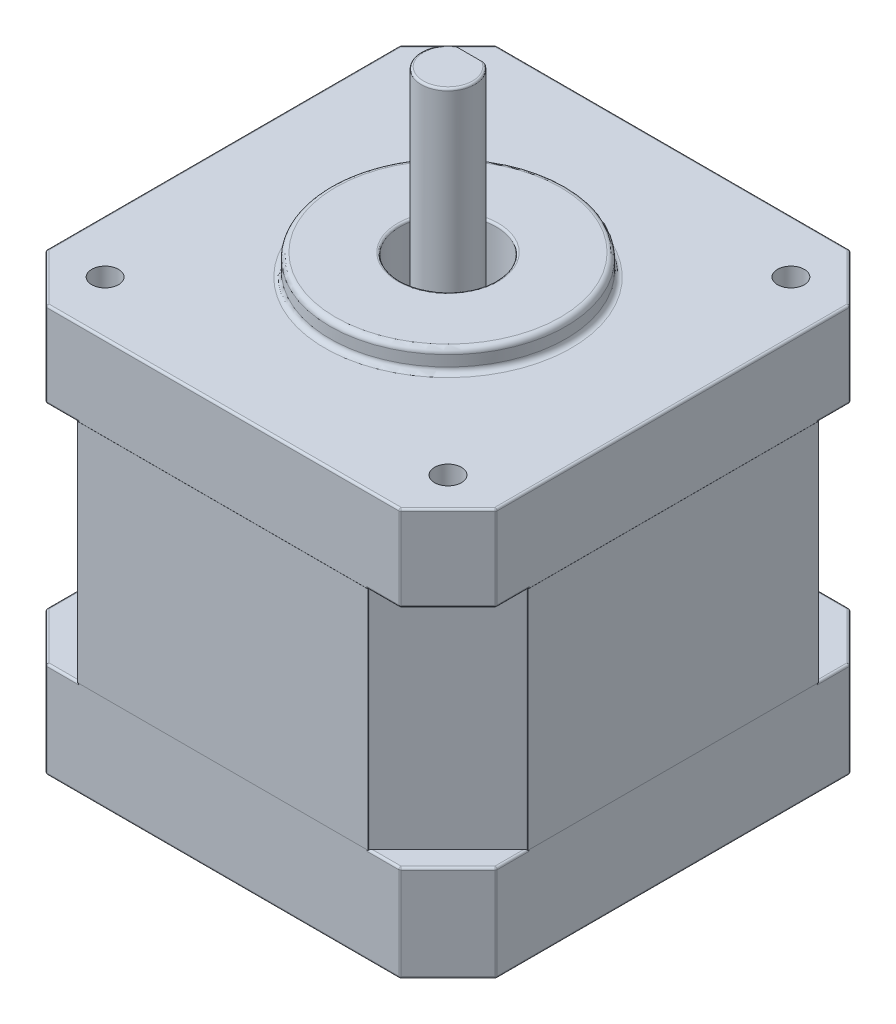
from build123d import *

# Parameters (mm, degrees)
IZIM1_R                          = 1.25
IZIM1_R_2                        = 4.5
Y_KSEKLIK_EKSTR_ZYON1_DEPTH      = 9
IZIM2_W                          = 16
IZIM2_H                          = 4
KES_EKSTR_ZYON1_DEPTH            = 6
IZIM3_W                          = 16
IZIM3_H                          = 5
Y_KSEKLIK_EKSTR_ZYON2_DEPTH      = 0.5
Y_KSEKLIK_EKSTR_ZYON3_DEPTH      = 5
IZIM6_R                          = 3
KES_EKSTR_ZYON2_DEPTH            = 3
IZIM7_R                          = 4.5
Y_KSEKLIK_EKSTR_ZYON4_DEPTH      = 21
IZIM8_R                          = 4.5
Y_KSEKLIK_EKSTR_ZYON5_DEPTH      = 8
IZIM9_R                          = 1.25
KES_EKSTR_ZYON3_DEPTH            = 45.544921147
IZIM10_R                         = 11
IZIM10_R_2                       = 4.5
Y_KSEKLIK_EKSTR_ZYON6_DEPTH      = 2
RADYUS1_R                        = 0.5
RADYUS2_R                        = 0.2
Y_KSEKLIK_EKSTR_ZYON7_DEPTH      = 11.5
Y_KSEKLIK_EKSTR_ZYON7_DEPTH_BACK = 11.5
IZIM11_R                         = 4.5
IZIM11_R_2                       = 2.5
RADYUS3_R                        = 0.2
IZIM12_R                         = 2.5
Y_KSEKLIK_EKSTR_ZYON8_DEPTH      = 50
IZIM13_W                         = 5.925379232
IZIM13_H                         = 1.11963419
KES_EKSTR_ZYON4_DEPTH            = 18
IZIM14_R                         = 0.25
Y_KSEKLIK_EKSTR_ZYON9_DEPTH      = 3
IZIM15_W                         = 16
IZIM15_H                         = 0.5
Y_KSEKLIK_EKSTR_ZYON11_DEPTH     = 5.5
IZIM17_W                         = 27.117157288
IZIM17_H                         = 21.117157288
Y_KSEKLIK_EKSTR_ZYON13_DEPTH     = 0.01
IZIM18_W                         = 27.117157288
IZIM18_H                         = 21.117157288
Y_KSEKLIK_EKSTR_ZYON14_DEPTH     = 0.01
IZIM19_W                         = 27.117157288
IZIM19_H                         = 21.117157288
Y_KSEKLIK_EKSTR_ZYON15_DEPTH     = 0.01
IZIM20_W                         = 27.117157288
IZIM20_H                         = 21.117157288
Y_KSEKLIK_EKSTR_ZYON16_DEPTH     = 0.01


with BuildPart() as part:
    # Çizim1 → Yükseklik-Ekstrüzyon1 (new body)
    with BuildSketch(Plane(origin=(0, 0, 0), x_dir=(1, 0, 0), z_dir=(0, 1, 0))):
        Polygon((-21, 16.5), (-16.5, 21), (-8, 21), (-8, 25), (8, 25), (8, 21), (16.5, 21), (21, 16.5), (21, -16.5), (16.5, -21), (-16.5, -21), (-21, -16.5), align=None)
        with Locations(Location((-16, 16, 0), (0, 0, 270))):
            Circle(IZIM1_R, mode=Mode.SUBTRACT)
        with Locations(Location((16, 16, 0), (0, 0, 90))):
            Circle(IZIM1_R, mode=Mode.SUBTRACT)
        with Locations(Location((16, -16, 0), (0, 0, 270))):
            Circle(IZIM1_R, mode=Mode.SUBTRACT)
        with Locations(Location((-16, -16, 0), (0, 0, 90))):
            Circle(IZIM1_R, mode=Mode.SUBTRACT)
        with Locations(Location((0, 0, 0), (0, 0, 270))):
            Circle(IZIM1_R_2, mode=Mode.SUBTRACT)
    extrude(amount=Y_KSEKLIK_EKSTR_ZYON1_DEPTH)

    # Çizim2 → Kes-Ekstrüzyon1 (cut)
    with BuildSketch(Plane(origin=(0, 9, 0), x_dir=(1, 0, 0), z_dir=(0, 1, 0))):
        with Locations((0, 23)):
            Rectangle(IZIM2_W, IZIM2_H)
    extrude(amount=-KES_EKSTR_ZYON1_DEPTH, mode=Mode.SUBTRACT)

    # Çizim3 → Yükseklik-Ekstrüzyon2 (add)
    with BuildSketch(Plane(origin=(0, 0, -21), x_dir=(-1, 0, 0), z_dir=(0, 0, -1))):
        with Locations((0, 6.5)):
            Rectangle(IZIM3_W, IZIM3_H)
    extrude(amount=Y_KSEKLIK_EKSTR_ZYON2_DEPTH)

    # Çizim4 → Yükseklik-Ekstrüzyon3 (add)
    with BuildSketch(Plane(origin=(0, 0, -21.5), x_dir=(-1, 0, 0), z_dir=(0, 0, -1))):
        Polygon((4, 9), (8, 9), (8, 4), (-8, 4), (-8, 9), (-4, 9), (-4, 8.5), (-7.5, 8.5), (-7.5, 4.5), (7.5, 4.5), (7.5, 8.5), (4, 8.5), align=None)
    extrude(amount=Y_KSEKLIK_EKSTR_ZYON3_DEPTH)

    # Çizim6 → Kes-Ekstrüzyon2 (cut)
    with BuildSketch(Plane.XZ):
        with Locations(Location((16, -16, 0), (0, 0, 270))):
            Circle(IZIM6_R)
        with Locations(Location((-16, -16, 0), (0, 0, 90))):
            Circle(IZIM6_R)
        with Locations(Location((-16, 16, 0), (0, 0, 270))):
            Circle(IZIM6_R)
        with Locations(Location((16, 16, 0), (0, 0, 90))):
            Circle(IZIM6_R)
    extrude(amount=-KES_EKSTR_ZYON2_DEPTH, mode=Mode.SUBTRACT)

    # Çizim7 → Yükseklik-Ekstrüzyon4 (add)
    with BuildSketch(Plane(origin=(0, 9, 0), x_dir=(1, 0, 0), z_dir=(0, 1, 0))):
        Polygon((-13.5, 21), (13.5, 21), (21, 13.5), (21, -13.5), (13.5, -21), (-13.5, -21), (-21, -13.5), (-21, 13.5), align=None)
        with Locations(Location((0, 0, 0), (0, 0, 270))):
            Circle(IZIM7_R, mode=Mode.SUBTRACT)
    extrude(amount=Y_KSEKLIK_EKSTR_ZYON4_DEPTH)

    # Çizim8 → Yükseklik-Ekstrüzyon5 (add)
    with BuildSketch(Plane(origin=(0, 30, 0), x_dir=(1, 0, 0), z_dir=(0, 1, 0))):
        Polygon((-16.5, 21), (16.5, 21), (21, 16.5), (21, -16.5), (16.5, -21), (-16.5, -21), (-21, -16.5), (-21, 16.5), align=None)
        with Locations(Location((0, 0, 0), (0, 0, 270))):
            Circle(IZIM8_R, mode=Mode.SUBTRACT)
    extrude(amount=Y_KSEKLIK_EKSTR_ZYON5_DEPTH)

    # Çizim9 → Kes-Ekstrüzyon3 (cut, through all)
    with BuildSketch(Plane.XZ.offset(-9)):
        with Locations(Location((-16, 16, 0), (0, 0, 270))):
            Circle(IZIM9_R)
        with Locations(Location((16, 16, 0), (0, 0, 270))):
            Circle(IZIM9_R)
        with Locations(Location((16, -16, 0), (0, 0, 270))):
            Circle(IZIM9_R)
        with Locations(Location((-16, -16, 0), (0, 0, 270))):
            Circle(IZIM9_R)
    extrude(amount=-KES_EKSTR_ZYON3_DEPTH, mode=Mode.SUBTRACT)

    # Çizim10 → Yükseklik-Ekstrüzyon6 (add)
    with BuildSketch(Plane(origin=(0, 38, 0), x_dir=(1, 0, 0), z_dir=(0, 1, 0))):
        with Locations(Location((0, 0, 0), (0, 0, 90))):
            Circle(IZIM10_R)
        with Locations(Location((0, 0, 0), (0, 0, 270))):
            Circle(IZIM10_R_2, mode=Mode.SUBTRACT)
    extrude(amount=Y_KSEKLIK_EKSTR_ZYON6_DEPTH)

    # Radyus1
    radyus1_edges = [part.edges().sort_by_distance(p)[0] for p in [
        (0, 38, 11),
        (0, 40, 11),
    ]]
    fillet(radyus1_edges, radius=RADYUS1_R)

    # Radyus2
    radyus2_edges = [part.edges().sort_by_distance(p)[0] for p in [
        (-21, 9, -15),
        (-8, 0, -23),
        (0, 0, -25),
        (8, 0, -23),
        (12.25, 0, -21),
        (18.75, 0, -18.75),
        (21, 0, 0),
        (-18.75, 9, 18.75),
        (18.75, 0, 18.75),
        (0, 0, 21),
        (-18.75, 0, 18.75),
        (-15, 9, -21),
        (-21, 9, 15),
        (15, 9, 21),
        (21, 9, -15),
        (-21, 0, 0),
        (-18.75, 0, -18.75),
        (-13.5, 19.5, -21),
        (-21, 19.5, -13.5),
        (-21, 19.5, 13.5),
        (-12.25, 0, -21),
        (-13.5, 19.5, 21),
        (13.5, 19.5, 21),
        (21, 19.5, 13.5),
        (21, 19.5, -13.5),
        (13.5, 19.5, -21),
        (-15, 9, 21),
        (-18.75, 38, -18.75),
        (-21, 38, 0),
        (-18.75, 38, 18.75),
        (0, 38, 21),
        (18.75, 38, 18.75),
        (21, 38, 0),
        (18.75, 38, -18.75),
        (0, 38, -21),
        (-18.75, 30, -18.75),
        (-16.5, 34, -21),
        (-21, 30, -15),
        (-21, 30, 15),
        (-21, 34, -16.5),
        (-18.75, 30, 18.75),
        (-21, 34, 16.5),
        (-15, 30, 21),
        (15, 30, 21),
        (-16.5, 34, 21),
        (18.75, 30, 18.75),
        (16.5, 34, 21),
        (21, 30, 15),
        (21, 30, -15),
        (21, 34, 16.5),
        (18.75, 30, -18.75),
        (21, 34, -16.5),
        (15, 30, -21),
        (-15, 30, -21),
        (16.5, 34, -21),
        (18.75, 9, 18.75),
        (16.5, 4.5, -21),
        (21, 4.5, -16.5),
        (21, 4.5, 16.5),
        (16.5, 4.5, 21),
        (-16.5, 4.5, 21),
        (-21, 4.5, 16.5),
        (-21, 4.5, -16.5),
        (-16.5, 4.5, -21),
        (21, 9, 15),
        (18.75, 9, -18.75),
        (15, 9, -21),
        (-8, 1.5, -21),
        (-8, 1.5, -25),
        (8, 1.5, -25),
        (8, 1.5, -21),
        (8, 3, -23),
        (0, 3, -21),
        (-8, 3, -23),
        (0, 3, -25),
        (-18.75, 9, -18.75),
    ]]
    fillet(radyus2_edges, radius=RADYUS2_R)

    # Çizim11 → Yükseklik-Ekstrüzyon7 (add, two sides: drawn at the far end of the back side and taken through both)
    with BuildSketch(Plane(origin=(0, 16.5, 0), x_dir=(-1, 0, 0), z_dir=(0, -1, 0)).offset(-Y_KSEKLIK_EKSTR_ZYON7_DEPTH_BACK)):
        with Locations(Location((0, 0, 0), (0, 0, 90))):
            Circle(IZIM11_R)
        with Locations(Location((0, 0, 0), (0, 0, 90))):
            Circle(IZIM11_R_2, mode=Mode.SUBTRACT)
    extrude(amount=Y_KSEKLIK_EKSTR_ZYON7_DEPTH + Y_KSEKLIK_EKSTR_ZYON7_DEPTH_BACK)

    # Radyus3
    radyus3_edges = [part.edges().sort_by_distance(p)[0] for p in [
        (16, 3, 13),
        (16, 0, 13),
        (-16, 3, 19),
        (-16, 0, 19),
        (-16, 3, -19),
        (-16, 0, -19),
        (16, 3, -13),
        (16, 3, -14.75),
        (16, 0, -13),
        (0, 40, -4.5),
        (0, 0, -4.5),
        (0, 5, -4.5),
        (0, 28, 2.5),
        (0, 5, 2.5),
    ]]
    fillet(radyus3_edges, radius=RADYUS3_R)

    # Çizim12 → Yükseklik-Ekstrüzyon8 (add)
    with BuildSketch(Plane.XZ.offset(-5)):
        with Locations(Location((0, 0, 0), (0, 0, 270))):
            Circle(IZIM12_R)
    extrude(amount=-Y_KSEKLIK_EKSTR_ZYON8_DEPTH)

    # Radyus4: read off the stored shape, not the designer's step
    # Radyus4 outline → Radyus4 (revolve, cut)
    with BuildSketch(Plane.XY):
        with BuildLine():
            ThreePointArc((2.3, 55), (2.441421356, 54.941421356), (2.5, 54.8))
            Line((2.5, 54.8), (2.5, 55))
            Line((2.5, 55), (2.3, 55))
        make_face()
    revolve(axis=Axis((0, 0, 0), (0, 1, 0)), mode=Mode.SUBTRACT)

    # Radyus4 2 outline → Radyus4 2 (revolve)
    with BuildSketch(Plane.XY):
        with BuildLine():
            Line((2.641143783, 5.008856217), (2.641143783, 5.2))
            Line((2.641143783, 5.2), (2.5, 5.2))
            Line((2.5, 5.2), (2.5, 5))
            ThreePointArc((2.5, 5), (2.569762983, 5.017319886), (2.641143783, 5.008856217))
        make_face()
    revolve(axis=Axis((0, 0, 0), (0, 1, 0)))

    # Çizim13 → Kes-Ekstrüzyon4 (cut)
    with BuildSketch(Plane(origin=(0, 55, 0), x_dir=(1, 0, 0), z_dir=(0, 1, 0))):
        with Locations((0, 2.559817095)):
            Rectangle(IZIM13_W, IZIM13_H)
    extrude(amount=-KES_EKSTR_ZYON4_DEPTH, mode=Mode.SUBTRACT)

    # Çizim14 → Yükseklik-Ekstrüzyon9 (add)
    with BuildSketch(Plane(origin=(0, 0, -21.5), x_dir=(-1, 0, 0), z_dir=(0, 0, -1))):
        with Locations(Location((-1.25, 7, 0), (0, 0, 180))):
            Circle(IZIM14_R)
        with Locations(Location((-3.75, 7, 0), (0, 0, 180))):
            Circle(IZIM14_R)
        with Locations(Location((-6.25, 7, 0), (0, 0, 180))):
            Circle(IZIM14_R)
        with Locations(Location((1.25, 7, 0), (0, 0, 180))):
            Circle(IZIM14_R)
        with Locations(Location((3.75, 7, 0), (0, 0, 180))):
            Circle(IZIM14_R)
        with Locations(Location((6.25, 7, 0), (0, 0, 180))):
            Circle(IZIM14_R)
    extrude(amount=Y_KSEKLIK_EKSTR_ZYON9_DEPTH)

    # Çizim15 → Yükseklik-Ekstrüzyon11 (add, through all)
    with BuildSketch(Plane(origin=(0, 0, -21), x_dir=(-1, 0, 0), z_dir=(0, 0, -1))):
        with Locations((0, 3.6)):
            Rectangle(IZIM15_W, IZIM15_H)
    extrude(amount=Y_KSEKLIK_EKSTR_ZYON11_DEPTH)

    # Çizim17 → Yükseklik-Ekstrüzyon13 (add)
    with BuildSketch(Plane(origin=(21, 0, 0), x_dir=(0, 0, -1), z_dir=(1, 0, 0))):
        with Locations((0, 19.5)):
            Rectangle(IZIM17_W, IZIM17_H)
    extrude(amount=Y_KSEKLIK_EKSTR_ZYON13_DEPTH)

    # Çizim18 → Yükseklik-Ekstrüzyon14 (add)
    with BuildSketch(Plane(origin=(0, 0, -21), x_dir=(-1, 0, 0), z_dir=(0, 0, -1))):
        with Locations((0, 19.5)):
            Rectangle(IZIM18_W, IZIM18_H)
    extrude(amount=Y_KSEKLIK_EKSTR_ZYON14_DEPTH)

    # Çizim19 → Yükseklik-Ekstrüzyon15 (add)
    with BuildSketch(Plane.ZY.offset(21)):
        with Locations((0, 19.5)):
            Rectangle(IZIM19_W, IZIM19_H)
    extrude(amount=Y_KSEKLIK_EKSTR_ZYON15_DEPTH)

    # Çizim20 → Yükseklik-Ekstrüzyon16 (add)
    with BuildSketch(Plane.XY.offset(21)):
        with Locations((0, 19.5)):
            Rectangle(IZIM20_W, IZIM20_H)
    extrude(amount=Y_KSEKLIK_EKSTR_ZYON16_DEPTH)


solid = part.part
